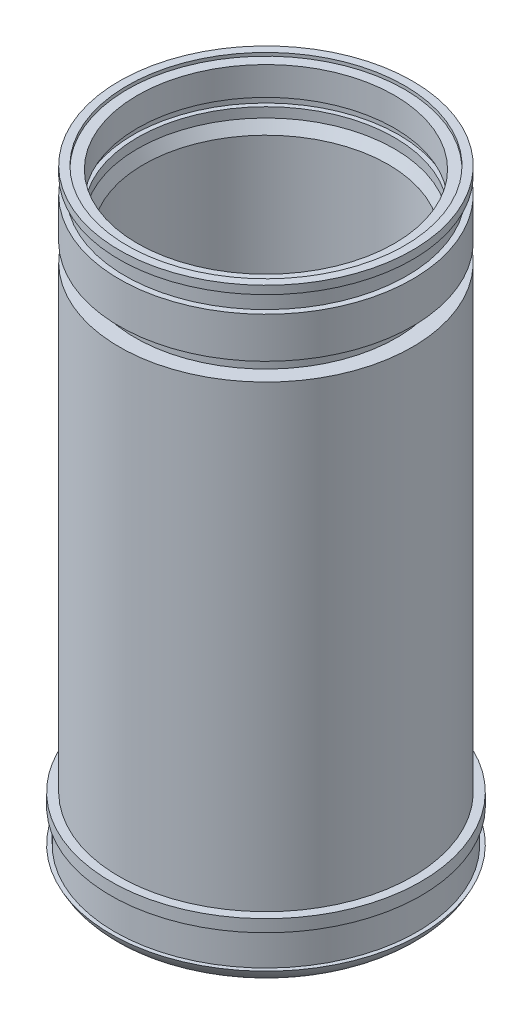
from build123d import *

# Parameters (mm, degrees)
FILLET1_R = 3.175
FILLET5_R = 12.7
FILLET6_R = 3.175


with BuildPart() as part:
    # Sketch1 → Revolve1 (revolve)
    with BuildSketch(Plane.XY, mode=Mode.PRIVATE) as revolve1_sk:
        Polygon((28.7274, 7.9375), (29.36875, 7.9375), (29.36875, 0), (60.3885, 0), (60.3885, 7.6835), (58.8645, 7.6835), (58.8645, 20.6375), (60.3885, 20.6375), (60.3885, 25.4), (57.0611, 25.4), (57.0611, 197.612), (57.0611, 203.962), (50.8635, 203.962), (50.8635, 210.947), (57.0611, 210.947), (57.0611, 226.822), (54.8386, 226.822), (54.8386, 233.426), (57.0611, 233.426), (57.0611, 236.601), (53.975, 236.601), (53.975, 235.331), (50, 235.331), (50, 224.25700005), (51.75, 224.25700005), (51.75, 221.107), (50, 221.107), (50, 217.297), (47.625, 213.183379332), (47.625, 30.1625), (28.7274, 26.9875), (28.7274, 26.289), (30.9499, 26.289), (30.9499, 19.685), (28.7274, 19.685), (28.7274, 18.0975), (34.925, 18.0975), (34.925, 11.1125), (28.7274, 11.1125), align=None)
    revolve(revolve1_sk.sketch.rotate(Axis((0, 0, 0), (0, 1, 0)), 90), axis=Axis((0, 0, 0), (0, 1, 0)))

    # Fillet1
    fillet1_edges = [part.edges().sort_by_distance(p)[0] for p in [
        (0, 30.1625, 47.625),
    ]]
    fillet(fillet1_edges, radius=FILLET1_R)

    # Fillet5
    # the kernel refuses this fillet: 12.7 mm, written as the material it takes off along each edge
    with BuildSketch(Plane(origin=(0, 0, 0), x_dir=(0, 0, -1), z_dir=(1, 0, 0))) as fillet5_piece_1:
        with BuildLine():
            CenterArc((48.721249778, 12.7), FILLET5_R, 270, 66.734025938)
            Line((60.3885, 7.6835), (60.621845004, 7.58317))
            ThreePointArc((60.621845004, 7.58317), (60.6425, 3.84175), (60.6425, 0))
            Line((60.6425, 0), (60.3885, -0.254))
            Line((60.3885, -0.254), (48.721249778, -0.254))
            Line((48.721249778, -0.254), (48.721249778, 0))
        make_face()
    revolve(axis=Axis((0, 0, 0), (0, 1, 0)), mode=Mode.SUBTRACT)

    # Fillet6
    fillet6_edges = [part.edges().sort_by_distance(p)[0] for p in [
        (0, 0, 29.36875),
    ]]
    fillet(fillet6_edges, radius=FILLET6_R)


solid = part.part
